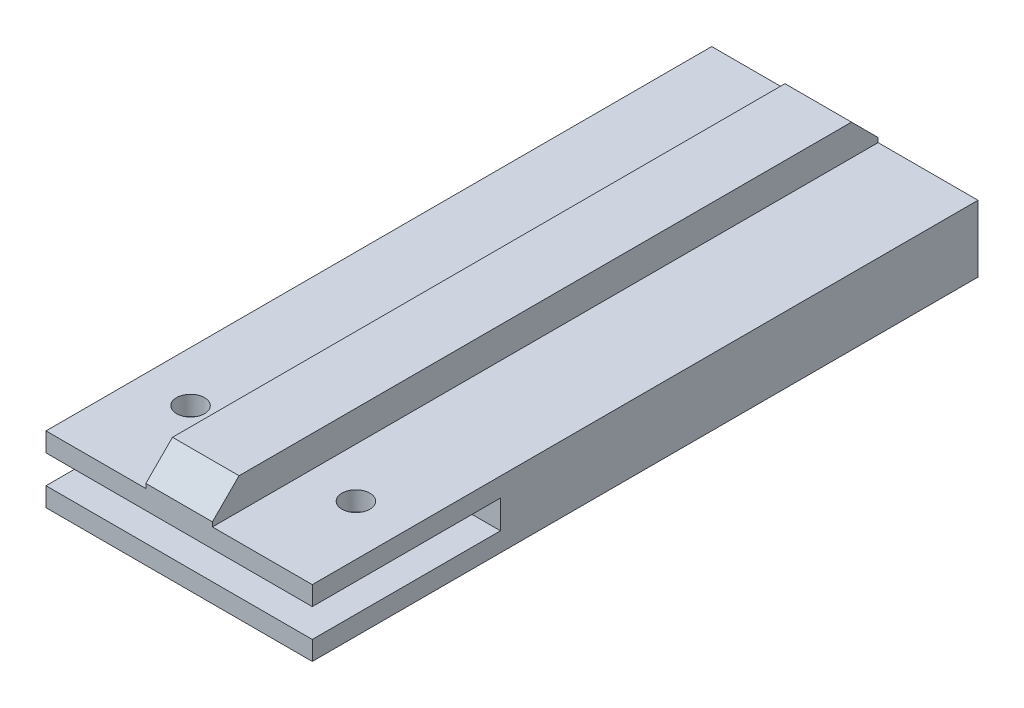
from build123d import *

# Parameters (mm, degrees)
SKETCH1_W           = 30
SKETCH1_H           = 7.5
BOSS_EXTRUDE1_DEPTH = 75
SKETCH6_W           = 21.2
SKETCH6_H           = 3.2
CUT_EXTRUDE5_DEPTH  = 82.124903698
SKETCH7_W           = 7.5
SKETCH7_H           = 75
BOSS_EXTRUDE4_DEPTH = 3.5
SKETCH8_R           = 1.575
CUT_EXTRUDE6_DEPTH  = 77.852130745
CHAMFER2_SIZE       = 3
CHAMFER3_SIZE       = 3


with BuildPart() as part:
    # Sketch1 → Boss-Extrude1 (new body)
    with BuildSketch(Plane.XY):
        with Locations((0, -3.75)):
            Rectangle(SKETCH1_W, SKETCH1_H)
    extrude(amount=BOSS_EXTRUDE1_DEPTH)

    # Sketch6 → Cut-Extrude5 (cut, through all)
    with BuildSketch(Plane(origin=(15, 0, 0), x_dir=(0, 0, -1), z_dir=(1, 0, 0))):
        with Locations((-64.4, -3.75)):
            Rectangle(SKETCH6_W, SKETCH6_H)
    extrude(amount=-CUT_EXTRUDE5_DEPTH, mode=Mode.SUBTRACT)

    # Sketch7 → Boss-Extrude4 (add)
    with BuildSketch(Plane(origin=(0, 0, 0), x_dir=(1, 0, 0), z_dir=(0, 1, 0))):
        with Locations((0, -37.5)):
            Rectangle(SKETCH7_W, SKETCH7_H)
    extrude(amount=BOSS_EXTRUDE4_DEPTH)

    # Sketch8 → Cut-Extrude6 (cut, symmetric)
    with BuildSketch(Plane(origin=(0, 0, 0), x_dir=(1, 0, 0), z_dir=(0, 1, 0))):
        with Locations((9.318388238, -64.4)):
            Circle(SKETCH8_R)
    cut_extrude6 = extrude(amount=CUT_EXTRUDE6_DEPTH, both=True, mode=Mode.SUBTRACT)

    # Mirror1: Cut-Extrude6 across plane
    add(cut_extrude6.mirror(Plane(origin=(0, 0, 0), x_dir=(0, 0, 1), z_dir=(1, 0, 0))), mode=Mode.SUBTRACT)

    # Chamfer2
    chamfer2_edges = [part.edges().sort_by_distance(p)[0] for p in [
        (0, 3.5, 75),
    ]]
    chamfer(chamfer2_edges, length=CHAMFER2_SIZE)

    # Chamfer3
    chamfer3_edges = [part.edges().sort_by_distance(p)[0] for p in [
        (0, 3.5, 0),
    ]]
    chamfer(chamfer3_edges, length=CHAMFER3_SIZE)


solid = part.part
